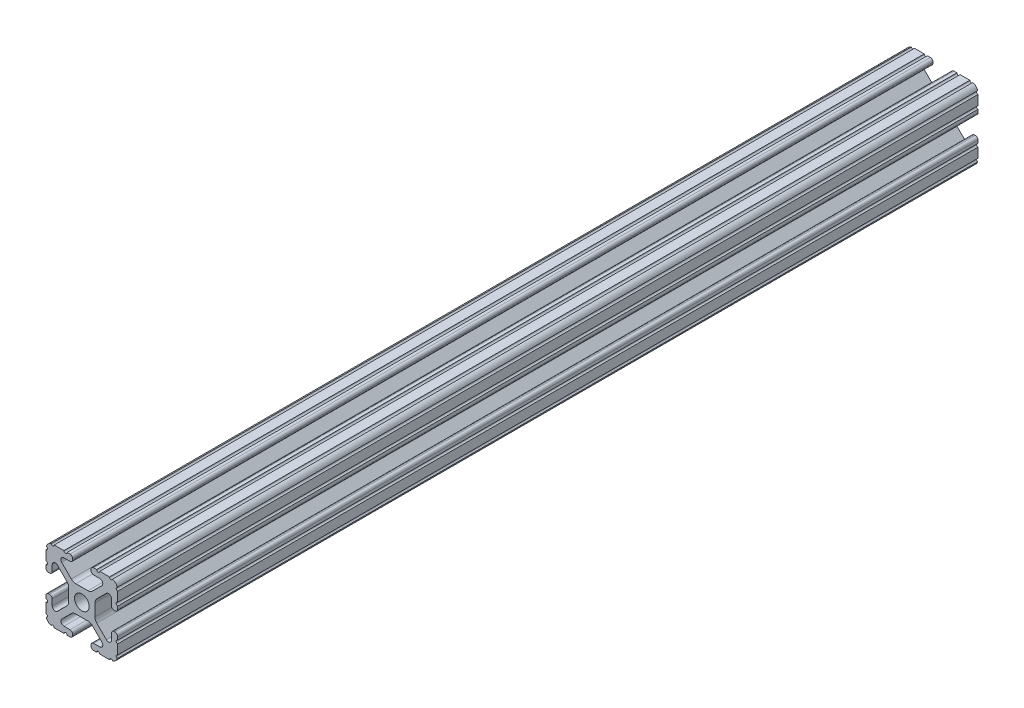
from build123d import *

# Parameters (mm, degrees)
BOSS_EXTRUDE1_DEPTH     = 304.8
CUT_EXTRUDE1_DEPTH      = 306.328708116
CUT_EXTRUDE1_DEPTH_BACK = 306.328708116
SKETCH5_R               = 0.55245
SKETCH6_W               = 73.397173187
SKETCH6_H               = 48.877854652
CUT_EXTRUDE2_DEPTH      = 304.8


with BuildPart() as part:
    # Sketch4 → Boss-Extrude1 (new, symmetric)
    with BuildSketch(Plane.XY):
        with BuildLine():
            Line((4.190365, -12.7), (10.11729625, -12.7))
            ThreePointArc((10.11729625, -12.7), (11.943543585, -11.943543585), (12.7, -10.11729625))
            Line((12.7, -10.11729625), (12.7, -4.190365))
            ThreePointArc((12.7, -4.190365), (12.42492494, -3.52627506), (11.760835, -3.2512))
            Line((11.760835, -3.2512), (11.429365, -3.2512))
            ThreePointArc((11.429365, -3.2512), (10.76527506, -3.52627506), (10.4902, -4.190365))
            Line((10.4902, -4.190365), (10.4902, -6.348478019))
            ThreePointArc((10.4902, -6.348478019), (9.830707141, -7.335478831), (8.666460301, -7.103895736))
            Line((8.666460301, -7.103895736), (5.299899128, -3.737334563))
            ThreePointArc((5.299899128, -3.737334563), (4.817571085, -3.015479634), (4.6482, -2.16399369))
            Line((4.6482, -2.16399369), (4.6482, 0))
            Line((4.6482, 0), (2.6035, 0))
            ThreePointArc((2.6035, 0), (1.840952505, -1.840952505), (0, -2.6035))
            Line((0, -2.6035), (0, -4.6482))
            Line((0, -4.6482), (2.16399369, -4.6482))
            ThreePointArc((2.16399369, -4.6482), (3.015479634, -4.817571085), (3.737334563, -5.299899128))
            Line((3.737334563, -5.299899128), (7.103895736, -8.666460301))
            ThreePointArc((7.103895736, -8.666460301), (7.335478831, -9.830707141), (6.348478019, -10.4902))
            Line((6.348478019, -10.4902), (4.190365, -10.4902))
            ThreePointArc((4.190365, -10.4902), (3.52627506, -10.76527506), (3.2512, -11.429365))
            Line((3.2512, -11.429365), (3.2512, -11.760835))
            ThreePointArc((3.2512, -11.760835), (3.52627506, -12.42492494), (4.190365, -12.7))
        make_face()
    extrude(amount=BOSS_EXTRUDE1_DEPTH, both=True)

    # Sketch5 → Cut-Extrude1 (cut, two sides: drawn at the far end of the back side and taken through both)
    with BuildSketch(Plane.XY.offset(-CUT_EXTRUDE1_DEPTH_BACK)):
        with Locations((10.356153152, -12.7)):
            Circle(SKETCH5_R)
        with Locations((5.796028019, -12.7)):
            Circle(SKETCH5_R)
        with Locations((12.7, -10.356153152)):
            Circle(SKETCH5_R)
        with Locations((12.7, -5.796028019)):
            Circle(SKETCH5_R)
    extrude(amount=CUT_EXTRUDE1_DEPTH + CUT_EXTRUDE1_DEPTH_BACK, mode=Mode.SUBTRACT)

    # Mirror1: part across plane


with BuildPart() as part_1:
    add(part.part)
    add(part.part.mirror(Plane(origin=(0, 0, 0), x_dir=(0, 0, 1), z_dir=(1, 0, 0))))

    # Mirror2: part across plane


with BuildPart() as part_2:
    add(part_1.part)
    add(part_1.part.mirror(Plane.ZX))

    # Sketch6 → Cut-Extrude2 (cut)
    with BuildSketch(Plane(origin=(0, 0, -304.8), x_dir=(-1, 0, 0), z_dir=(0, 0, -1))):
        with Locations((-1.205868125, 1.286259333)):
            Rectangle(SKETCH6_W, SKETCH6_H)
    extrude(amount=-CUT_EXTRUDE2_DEPTH, mode=Mode.SUBTRACT)


solid = part_2.part
